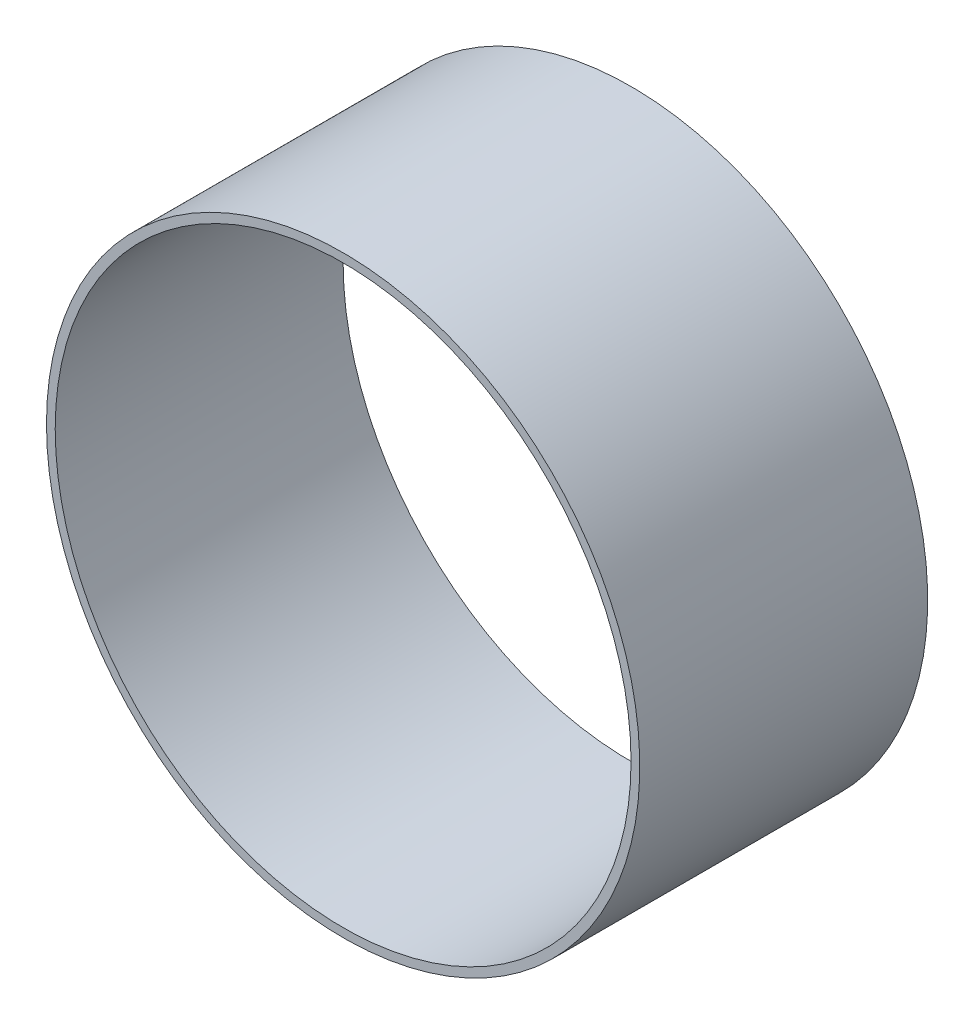
from build123d import *

# Parameters (mm, degrees)
SKETCH1_R           = 39.2557
SKETCH1_R_2         = 38.1
BOSS_EXTRUDE1_DEPTH = 19.05


with BuildPart() as part:
    # Sketch1 → Boss-Extrude1 (new, symmetric)
    with BuildSketch(Plane.XY):
        Circle(SKETCH1_R)
        Circle(SKETCH1_R_2, mode=Mode.SUBTRACT)
    extrude(amount=BOSS_EXTRUDE1_DEPTH, both=True)


solid = part.part
